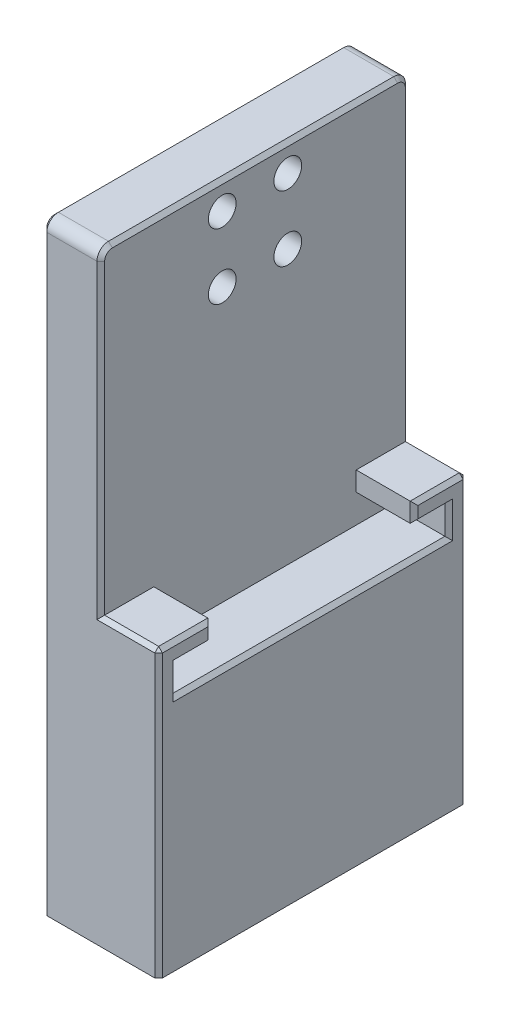
from build123d import *

# Parameters (mm, degrees)
SKETCH1_W               = 100
SKETCH1_H               = 26
BOSS_EXTRUDE1_DEPTH     = 2
BOSS_EXTRUDE2_DEPTH     = 100
SKETCH3_W               = 25
SKETCH3_H               = 28
BOSS_EXTRUDE3_DEPTH     = 4
SKETCH4_R               = 2.1
CUT_EXTRUDE1_DEPTH      = 106.39449701
CUT_EXTRUDE2_DEPTH      = 105.537074763
CUT_EXTRUDE2_DEPTH_BACK = 105.537074763
SKETCH5_W               = 120
SKETCH5_H               = 46
SKETCH5_W_2             = 100
SKETCH5_H_2             = 26
SKETCH6_W               = 100
SKETCH6_H               = 26
SKETCH6_R               = 3.6
BOSS_EXTRUDE4_DEPTH     = 4.2
SKETCH8_W               = 100
SKETCH8_H               = 4
BOSS_EXTRUDE5_DEPTH     = 6
SKETCH9_W               = 100
SKETCH9_H               = 4
BOSS_EXTRUDE6_DEPTH     = 10.2
SKETCH10_W              = 4
SKETCH10_H              = 37.5
CUT_EXTRUDE3_DEPTH      = 106.682732743
SKETCH11_W              = 4
SKETCH11_H              = 25
CUT_EXTRUDE4_DEPTH      = 107.737247482
SKETCH13_W              = 10
SKETCH13_H              = 10
BOSS_EXTRUDE7_DEPTH     = 6.2
SKETCH14_W              = 4.2
SKETCH14_H              = 35.5
CUT_EXTRUDE5_DEPTH      = 107.737247482
SKETCH15_W              = 6
SKETCH15_H              = 100
CUT_EXTRUDE6_DEPTH      = 109.576424697
PODPORA_START           = -80
PODPORA_DEPTH           = 80
PODPORA_2_OUTLINE_W     = 10
PODPORA_2_OUTLINE_H     = 12.4
PODPORA_2_DEPTH         = 9.75
PODPORA_START_2         = -9.75
PODPORA_3_OUTLINE_W     = 10
PODPORA_3_OUTLINE_H     = 12.4
PODPORA_3_DEPTH         = 9.75
PODPORA_START_3         = -70.25
PODPORA_4_OUTLINE_W     = 10
PODPORA_4_OUTLINE_H     = 5
PODPORA_4_DEPTH         = 4
PODPORA_START_4         = -13.75
PODPORA_5_OUTLINE_W     = 10
PODPORA_5_OUTLINE_H     = 5
PODPORA_5_DEPTH         = 4
SKETCH16_W              = 80
SKETCH16_H              = 115
BOSS_EXTRUDE8_DEPTH     = 10
MOVE_FACE1_BY           = 10
MOVE_FACE2_BY           = 5
SKETCH17_W              = 10
SKETCH17_H              = 30
CUT_EXTRUDE7_DEPTH      = 150.52822476
MOVE_START              = 12.4
MOVE_FACE3_OUTLINE_R    = 3.6
MOVE_FACE3_DEPTH        = 3.8
SKETCH18_W              = 35.995257081
SKETCH18_H              = 98.541471116
CUT_EXTRUDE8_DEPTH      = 178.196049617
MOVE_FACE4_BY           = 4
DELETEFACE1_START       = 6.2
DELETEFACE1_OUTLINE_W   = 30
DELETEFACE1_OUTLINE_H   = 25.5
DELETEFACE1_DEPTH       = 4.2
SKETCH19_W              = 80
SKETCH19_H              = 10
CUT_EXTRUDE9_DEPTH      = 136.525827797
MOVE_START_2            = 106.5
MOVE_FACE5_OUTLINE_W    = 10
MOVE_FACE5_OUTLINE_H    = 80
MOVE_FACE5_DEPTH        = 2
FILLET1_R               = 3
MOVE_START_3            = -48.5
MOVE_FACE6_OUTLINE_W    = 25
MOVE_FACE6_OUTLINE_H    = 80
MOVE_FACE6_DEPTH        = 0.5
MOVE_START_4            = 1.2
MOVE_FACE7_OUTLINE_R    = 2.1
MOVE_FACE7_DEPTH        = 5
MOVE_FACE8_BY           = 5
MOVE_FACE8_2_BY         = 5
CHAMFER1_SIZE           = 1


with BuildPart() as part:
    # Sketch1 → Boss-Extrude1 (new body)
    with BuildSketch(Plane(origin=(0, 0, 0), x_dir=(0, 0, -1), z_dir=(1, 0, 0))):
        with Locations((50, 13)):
            Rectangle(SKETCH1_W, SKETCH1_H)
    extrude(amount=BOSS_EXTRUDE1_DEPTH)

    # Sketch2 → Boss-Extrude2 (add)
    with BuildSketch(Plane.XY):
        Polygon((2, 26), (2, 28), (-12, 28), (-12, 24), (-10, 24), (-10, 26), align=None)
    extrude(amount=-BOSS_EXTRUDE2_DEPTH)

    # Sketch3 → Boss-Extrude3 (add)
    with BuildSketch(Plane(origin=(2, 0, 0), x_dir=(0, 0, -1), z_dir=(1, 0, 0))):
        with Locations((50, 14)):
            Rectangle(SKETCH3_W, SKETCH3_H)
    extrude(amount=BOSS_EXTRUDE3_DEPTH)

    # Sketch4 → Cut-Extrude1 (cut, through all)
    with BuildSketch(Plane(origin=(6, 0, 0), x_dir=(0, 0, -1), z_dir=(1, 0, 0))):
        with Locations((41.5, 21)):
            Circle(SKETCH4_R)
        with Locations((58.5, 21)):
            Circle(SKETCH4_R)
        with Locations((58.5, 4)):
            Circle(SKETCH4_R)
        with Locations((41.5, 4)):
            Circle(SKETCH4_R)
    extrude(amount=-CUT_EXTRUDE1_DEPTH, mode=Mode.SUBTRACT)


with BuildPart() as body_2:
    # Mirror1: mirrored copy
    add(part.part.mirror(Plane(origin=(6, 0, 0), x_dir=(0, 0, 1), z_dir=(1, 0, 0))))

    # Sketch5 → Cut-Extrude2 (cut, two sides: drawn at the far end of the back side and taken through both)
    with BuildSketch(Plane(origin=(12, 0, 0), x_dir=(0, 0, -1), z_dir=(1, 0, 0)).offset(-CUT_EXTRUDE2_DEPTH_BACK)):
        with Locations((50, 13)):
            Rectangle(SKETCH5_W, SKETCH5_H)
        with Locations((50, 13)):
            Rectangle(SKETCH5_W_2, SKETCH5_H_2, mode=Mode.SUBTRACT)
    extrude(amount=CUT_EXTRUDE2_DEPTH + CUT_EXTRUDE2_DEPTH_BACK, mode=Mode.SUBTRACT)


with BuildPart() as body_2_2:
    # of the pieces the cut leaves, the one that is kept (cut_extrude2_keep)
    add(body_2.part.solids().sort_by_distance((12, 0, 0))[0])

    # Sketch6 → Boss-Extrude4 (add)
    with BuildSketch(Plane(origin=(12, 0, 0), x_dir=(0, 0, -1), z_dir=(1, 0, 0))):
        with Locations((50, 13)):
            Rectangle(SKETCH6_W, SKETCH6_H)
        with Locations((41.5, 21)):
            Circle(SKETCH6_R, mode=Mode.SUBTRACT)
        with Locations((58.5, 21)):
            Circle(SKETCH6_R, mode=Mode.SUBTRACT)
        with Locations((58.5, 4)):
            Circle(SKETCH6_R, mode=Mode.SUBTRACT)
        with Locations((41.5, 4)):
            Circle(SKETCH6_R, mode=Mode.SUBTRACT)
    extrude(amount=BOSS_EXTRUDE4_DEPTH)



with BuildPart() as body_2_3:
    # Sketch8 → Boss-Extrude5 (new body)
    with BuildSketch(Plane(origin=(16.2, 0, 0), x_dir=(0, 0, -1), z_dir=(1, 0, 0))):
        with Locations((50, -2)):
            Rectangle(SKETCH8_W, SKETCH8_H)
    extrude(amount=BOSS_EXTRUDE5_DEPTH)


with BuildPart() as body_2_2_1:
    add(body_2_2.part)

    add(body_2_3.part)  # Boss-Extrude6 merges body 2 3
    # Sketch9 → Boss-Extrude6 (add)
    with BuildSketch(Plane.ZY.offset(-16.2)):
        with Locations((-50, -2)):
            Rectangle(SKETCH9_W, SKETCH9_H)
    extrude(amount=BOSS_EXTRUDE6_DEPTH)

    # Sketch10 → Cut-Extrude3 (cut, through all)
    with BuildSketch(Plane(origin=(0, 0, 0), x_dir=(1, 0, 0), z_dir=(0, 1, 0))):
        with Locations((8, 81.25)):
            Rectangle(SKETCH10_W, SKETCH10_H)
        with Locations((8, 18.75)):
            Rectangle(SKETCH10_W, SKETCH10_H)
    extrude(amount=-CUT_EXTRUDE3_DEPTH, mode=Mode.SUBTRACT)

    # Sketch11 → Cut-Extrude4 (cut, through all)
    with BuildSketch(Plane(origin=(0, 26, 0), x_dir=(1, 0, 0), z_dir=(0, 1, 0))):
        with Locations((8, 50)):
            Rectangle(SKETCH11_W, SKETCH11_H)
    extrude(amount=-CUT_EXTRUDE4_DEPTH, mode=Mode.SUBTRACT)

    # Sketch13 → Boss-Extrude7 (add)
    with BuildSketch(Plane.ZY.offset(-10)):
        with Locations((-50, 31)):
            Rectangle(SKETCH13_W, SKETCH13_H)
    extrude(amount=-BOSS_EXTRUDE7_DEPTH)

    # Sketch14 → Cut-Extrude5 (cut, through all)
    with BuildSketch(Plane(origin=(0, 26, 0), x_dir=(1, 0, 0), z_dir=(0, 1, 0))):
        with Locations((12.1, 17.75)):
            Rectangle(SKETCH14_W, SKETCH14_H)
        with Locations((12.1, 82.25)):
            Rectangle(SKETCH14_W, SKETCH14_H)
    extrude(amount=-CUT_EXTRUDE5_DEPTH, mode=Mode.SUBTRACT)

    # Sketch15 → Cut-Extrude6 (cut, through all)
    with BuildSketch(Plane(origin=(0, 0, 0), x_dir=(1, 0, 0), z_dir=(0, 1, 0))):
        with Locations((19.2, 50)):
            Rectangle(SKETCH15_W, SKETCH15_H)
    extrude(amount=-CUT_EXTRUDE6_DEPTH, mode=Mode.SUBTRACT)


with BuildPart() as body_2_4:
    # podpora: read off the stored shape, not the designer's step
    # podpora outline → podpora (new body)
    with BuildSketch(Plane.XY.offset(PODPORA_START)):
        Polygon((-3.8, -48.5), (26.2, -48.5), (26.2, 13.6), (16.2, 13.6), (16.2, -38.5), (-3.8, -38.5), align=None)
    extrude(amount=PODPORA_DEPTH)

    # podpora 2 outline → podpora 2 (add)
    with BuildSketch(Plane.XY.offset(PODPORA_START)):
        with Locations((21.2, 19.8)):
            Rectangle(PODPORA_2_OUTLINE_W, PODPORA_2_OUTLINE_H)
    extrude(amount=PODPORA_2_DEPTH)

    # podpora 3 outline → podpora 3 (add)
    with BuildSketch(Plane.XY.offset(PODPORA_START_2)):
        with Locations((21.2, 19.8)):
            Rectangle(PODPORA_3_OUTLINE_W, PODPORA_3_OUTLINE_H)
    extrude(amount=PODPORA_3_DEPTH)

    # podpora 4 outline → podpora 4 (add)
    with BuildSketch(Plane.XY.offset(PODPORA_START_3)):
        with Locations((21.2, 23.5)):
            Rectangle(PODPORA_4_OUTLINE_W, PODPORA_4_OUTLINE_H)
    extrude(amount=PODPORA_4_DEPTH)

    # podpora 5 outline → podpora 5 (add)
    with BuildSketch(Plane.XY.offset(PODPORA_START_4)):
        with Locations((21.2, 23.5)):
            Rectangle(PODPORA_5_OUTLINE_W, PODPORA_5_OUTLINE_H)
    extrude(amount=PODPORA_5_DEPTH)

    # Move Face1: a face moved outward by 10.0
    extrude(body_2_4.faces().sort_by_distance((-3.8, -43.5, -40))[0], amount=MOVE_FACE1_BY, dir=(-1, 0, 0))

    # Move Face2: a face moved outward by 5.0
    extrude(body_2_4.faces().sort_by_distance((26.2, -15.422294183, -40))[0], amount=MOVE_FACE2_BY, dir=(1, 0, 0))


with BuildPart() as body_2_2_2:
    # Body-Move/Copy3: moved
    add(body_2_2_1.part.moved(Location((0, 0, 10))))


with BuildPart() as body_2_2_3:
    # Body-Move/Copy4: read off the stored shape, not the designer's step
    # Body-Move/Copy4: moved
    add(body_2_2_2.part.moved(Location((0, 17.6, 0))))


with BuildPart() as body_3:
    # Sketch16 → Boss-Extrude8 (new body)
    with BuildSketch(Plane.ZY.offset(-16.2)):
        with Locations((-40, 19)):
            Rectangle(SKETCH16_W, SKETCH16_H)
    extrude(amount=BOSS_EXTRUDE8_DEPTH)

    # Combine1: union body 2 4
    add(body_2_4.part)


with BuildPart() as body_2_2_4:
    # Body-Move/Copy5: read off the stored shape, not the designer's step
    # Body-Move/Copy5: moved
    add(body_2_2_3.part.moved(Location((0, 62.9, 0))))


with BuildPart() as body_2_2_5:
    # Body-Move/Copy6: read off the stored shape, not the designer's step
    # Body-Move/Copy6: moved
    add(body_2_2_4.part.moved(Location((-3.8, 0, 0))))

    # Combine2: union body 3
    add(body_3.part)

    # Sketch17 → Cut-Extrude7 (cut, through all)
    with BuildSketch(Plane(origin=(12.4, 0, 0), x_dir=(0, 0, -1), z_dir=(1, 0, 0))):
        with Locations((-5, 91.5)):
            Rectangle(SKETCH17_W, SKETCH17_H)
        with Locations((85, 91.5)):
            Rectangle(SKETCH17_W, SKETCH17_H)
    extrude(amount=-CUT_EXTRUDE7_DEPTH, mode=Mode.SUBTRACT)

    # Move Face3: read off the stored shape, not the designer's step
    # Move Face3 outline → Move Face3 (add)
    with BuildSketch(Plane.YZ.offset(MOVE_START)):
        Polygon((116.5, -35), (106.5, -35), (106.5, 0), (76.5, 0), (76.5, -80), (106.5, -80), (106.5, -45), (116.5, -45), align=None)
        with Locations((84.5, -48.5)):
            Circle(MOVE_FACE3_OUTLINE_R, mode=Mode.SUBTRACT)
        with Locations((101.5, -48.5)):
            Circle(MOVE_FACE3_OUTLINE_R, mode=Mode.SUBTRACT)
        with Locations((84.5, -31.5)):
            Circle(MOVE_FACE3_OUTLINE_R, mode=Mode.SUBTRACT)
        with Locations((101.5, -31.5)):
            Circle(MOVE_FACE3_OUTLINE_R, mode=Mode.SUBTRACT)
    extrude(amount=MOVE_FACE3_DEPTH)

    # Sketch18 → Cut-Extrude8 (cut, through all)
    with BuildSketch(Plane(origin=(0, 106.5, 0), x_dir=(1, 0, 0), z_dir=(0, 1, 0))):
        with Locations((13.065761379, 40)):
            Rectangle(SKETCH18_W, SKETCH18_H)
    extrude(amount=CUT_EXTRUDE8_DEPTH, mode=Mode.SUBTRACT)

    # Move Face4: a face moved outward by 4.0
    extrude(body_2_2_5.faces().sort_by_distance((-13.8, -43.5, -40))[0], amount=MOVE_FACE4_BY, dir=(-1, 0, 0))

    # DeleteFace1: read off the stored shape, not the designer's step
    # DeleteFace1 outline → DeleteFace1 (add)
    with BuildSketch(Plane.YZ.offset(DELETEFACE1_START)):
        with Locations((91.5, -67.25)):
            Rectangle(DELETEFACE1_OUTLINE_W, DELETEFACE1_OUTLINE_H)
        with Locations((91.5, -12.75)):
            Rectangle(DELETEFACE1_OUTLINE_W, DELETEFACE1_OUTLINE_H)
    extrude(amount=DELETEFACE1_DEPTH)

    # Sketch19 → Cut-Extrude9 (cut, through all)
    with BuildSketch(Plane.ZY.offset(-6.2)):
        with Locations((-40, -43.5)):
            Rectangle(SKETCH19_W, SKETCH19_H)
    extrude(amount=CUT_EXTRUDE9_DEPTH, mode=Mode.SUBTRACT)

    # Move Face5: read off the stored shape, not the designer's step
    # Move Face5 outline → Move Face5 (add)
    with BuildSketch(Plane(origin=(0, 0, 0), x_dir=(1, 0, 0), z_dir=(0, 1, 0)).offset(MOVE_START_2)):
        with Locations((11.2, 40)):
            Rectangle(MOVE_FACE5_OUTLINE_W, MOVE_FACE5_OUTLINE_H)
    extrude(amount=MOVE_FACE5_DEPTH)

    # Fillet1
    fillet1_edges = [body_2_2_5.edges().sort_by_distance(p)[0] for p in [
        (11.2, 108.5, 0),
        (11.2, 108.5, -80),
    ]]
    fillet(fillet1_edges, radius=FILLET1_R)

    # Move Face6: read off the stored shape, not the designer's step
    # Move Face6 outline → Move Face6 (cut)
    with BuildSketch(Plane(origin=(0, 0, 0), x_dir=(1, 0, 0), z_dir=(0, 1, 0)).offset(MOVE_START_3)):
        with Locations((18.7, 40)):
            Rectangle(MOVE_FACE6_OUTLINE_W, MOVE_FACE6_OUTLINE_H)
    extrude(amount=MOVE_FACE6_DEPTH, mode=Mode.SUBTRACT)

    # Move Face7: read off the stored shape, not the designer's step
    # Move Face7 outline → Move Face7 (add)
    with BuildSketch(Plane.YZ.offset(MOVE_START_4)):
        with BuildLine():
            Line((-48, -80), (105.5, -80))
            ThreePointArc((105.5, -80), (107.621320344, -79.121320344), (108.5, -77))
            Line((108.5, -77), (108.5, -3))
            ThreePointArc((108.5, -3), (107.621320344, -0.878679656), (105.5, 0))
            Line((105.5, 0), (-48, 0))
            Line((-48, 0), (-48, -80))
        make_face()
        with Locations((84.5, -48.5)):
            Circle(MOVE_FACE7_OUTLINE_R, mode=Mode.SUBTRACT)
        with Locations((101.5, -48.5)):
            Circle(MOVE_FACE7_OUTLINE_R, mode=Mode.SUBTRACT)
        with Locations((84.5, -31.5)):
            Circle(MOVE_FACE7_OUTLINE_R, mode=Mode.SUBTRACT)
        with Locations((101.5, -31.5)):
            Circle(MOVE_FACE7_OUTLINE_R, mode=Mode.SUBTRACT)
    extrude(amount=MOVE_FACE7_DEPTH)

    # Move Face8: a face moved inward by 5.0
    extrude(body_2_2_5.faces().sort_by_distance((23.7, 17.3, -70.25))[0], amount=MOVE_FACE8_BY, dir=(0, 0, -1), mode=Mode.SUBTRACT)

    # Move Face8 2: a face moved inward by 5.0
    extrude(body_2_2_5.faces().sort_by_distance((23.7, 17.3, -9.75))[0], amount=MOVE_FACE8_2_BY, dir=(0, 0, 1), mode=Mode.SUBTRACT)

    # Chamfer1
    chamfer1_edges = [body_2_2_5.edges().sort_by_distance(p)[0] for p in [
        (23.7, 26, -80),
        (31.2, -11, -80),
        (31.2, -11, 0),
        (16.2, 65.75, 0),
        (1.2, 28.75, 0),
        (31.2, 26, -6.875),
        (23.7, 26, 0),
        (31.2, 23.5, -13.75),
        (31.2, 21, -9.25),
        (31.2, 17.3, -4.75),
        (31.2, 13.6, -40),
        (31.2, 17.3, -75.25),
        (31.2, 21, -70.75),
        (31.2, 23.5, -66.25),
        (31.2, 26, -73.125),
        (1.2, 108.5, -40),
        (16.2, 108.5, -40),
        (16.2, 65.75, -80),
        (16.2, 107.621320344, -79.121320344),
        (16.2, 107.621320344, -0.878679656),
        (1.2, 28.75, -80),
        (1.2, 107.621320344, -79.121320344),
        (1.2, 107.621320344, -0.878679656),
    ]]
    chamfer(chamfer1_edges, length=CHAMFER1_SIZE)


solid = body_2_2_5.part
